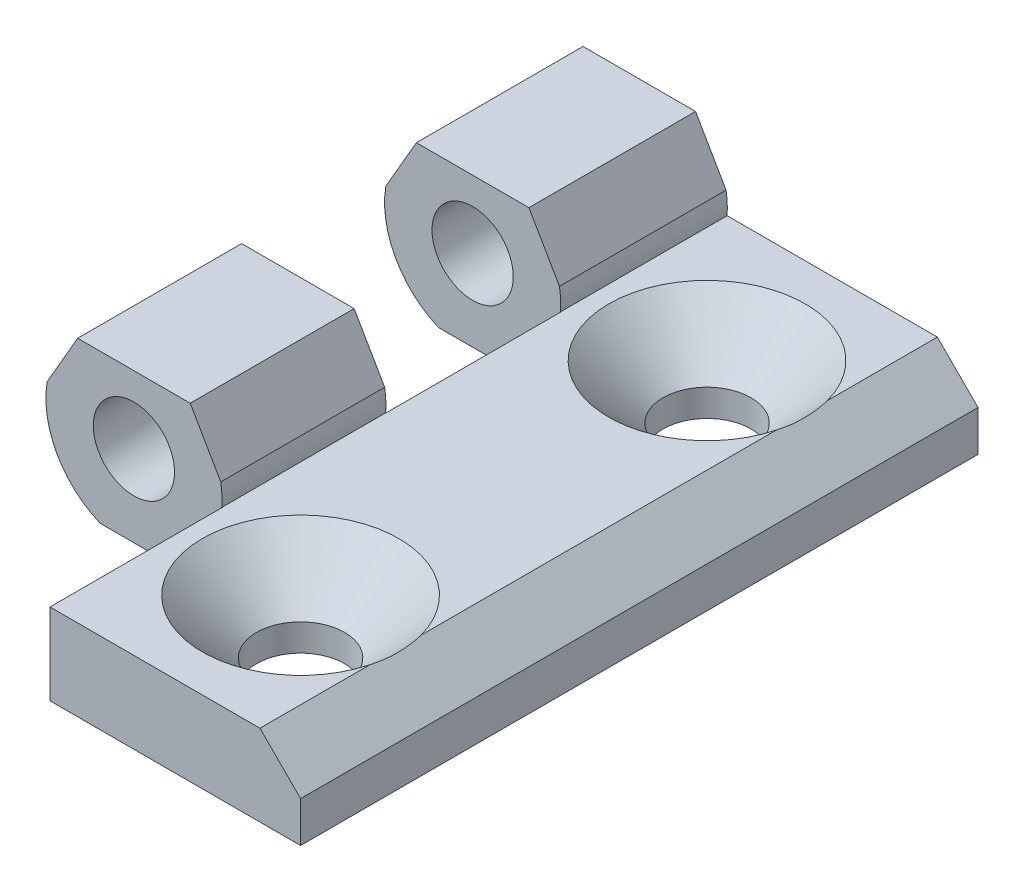
from build123d import *

# Parameters (mm, degrees)
SKETCH2_R           = 3
BOSS_EXTRUDE1_DEPTH = 25
SKETCH3_R           = 3.25
CUT_EXTRUDE1_DEPTH  = 36.860842154
CHAMFER1_SIZE       = 4
CUT_EXTRUDE2_DEPTH  = 57.278326201
SKETCH5_W           = 13
SKETCH5_H           = 12.5
CUT_EXTRUDE3_DEPTH  = 38.17862289
SKETCH6_W           = 13
SKETCH6_H           = 0.2
CUT_EXTRUDE4_DEPTH  = 38.17862289


with BuildPart() as part:
    # Sketch2 → Boss-Extrude1 (new, symmetric)
    with BuildSketch(Plane.XY):
        with BuildLine():
            Line((25, -6.5), (2, -6.5))
            Line((2, -6.5), (2, -6))
            Line((2, -6), (-2.5, -6))
            ThreePointArc((-2.5, -6), (-6.427802106, -0.966105629), (-4.153311931, 5))
            Line((-4.153311931, 5), (4.153311931, 5))
            ThreePointArc((4.153311931, 5), (5.986089611, 2.533126757), (6.480740698, -0.5))
            Line((6.480740698, -0.5), (22, -0.5))
            Line((22, -0.5), (25, -3.5))
            Line((25, -3.5), (25, -6.5))
        make_face()
        Circle(SKETCH2_R, mode=Mode.SUBTRACT)
    extrude(amount=BOSS_EXTRUDE1_DEPTH, both=True)

    # Sketch3 → Cut-Extrude1 (cut, through all)
    with BuildSketch(Plane(origin=(0, -0.5, 0), x_dir=(1, 0, 0), z_dir=(0, 1, 0))):
        with Locations(Location((15, 15, 0), (0, 0, 180))):
            Circle(SKETCH3_R)
        with Locations(Location((15, -15, 0), (0, 0, 180))):
            Circle(SKETCH3_R)
    extrude(amount=-CUT_EXTRUDE1_DEPTH, mode=Mode.SUBTRACT)

    # Chamfer1
    # the kernel refuses this chamfer: 4 mm, written as the material it takes off along each edge
    with BuildSketch(Plane(origin=(15, -0.5, -15), x_dir=(-1, 0, 0), z_dir=(0, 0, -1))) as chamfer1_piece_1:
        Polygon((3.25, -CHAMFER1_SIZE), (3.25 + CHAMFER1_SIZE, 0), (3.25, 0), align=None)
    revolve(axis=Axis((15, -0.5, -15), (0, 1, 0)), mode=Mode.SUBTRACT)
    with BuildSketch(Plane(origin=(15, -0.5, 15), x_dir=(-1, 0, 0), z_dir=(0, 0, -1))) as chamfer1_piece_2:
        Polygon((3.25, -CHAMFER1_SIZE), (3.25 + CHAMFER1_SIZE, 0), (3.25, 0), align=None)
    revolve(axis=Axis((15, -0.5, 15), (0, 1, 0)), mode=Mode.SUBTRACT)

    # Sketch4 → Cut-Extrude2 (cut, through all)
    with BuildSketch(Plane.XY.offset(25)):
        with BuildLine():
            Line((6.406782985, 1.096873642), (4.153311931, 5))
            ThreePointArc((4.153311931, 5), (5.629165125, 3.25), (6.406782985, 1.096873642))
        make_face()
        with BuildLine():
            Line((-4.153311931, 5), (-6.406782985, 1.096873642))
            ThreePointArc((-6.406782985, 1.096873642), (-5.629165125, 3.25), (-4.153311931, 5))
        make_face()
    extrude(amount=-CUT_EXTRUDE2_DEPTH, mode=Mode.SUBTRACT)

    # Sketch5 → Cut-Extrude3 (cut, through all)
    with BuildSketch(Plane(origin=(0, 5, 0), x_dir=(1, 0, 0), z_dir=(0, 1, 0))):
        with Locations((0, -18.75)):
            Rectangle(SKETCH5_W, SKETCH5_H)
        with Locations((0, 6.25)):
            Rectangle(SKETCH5_W, SKETCH5_H)
    extrude(amount=-CUT_EXTRUDE3_DEPTH, mode=Mode.SUBTRACT)

    # Sketch6 → Cut-Extrude4 (cut, through all)
    with BuildSketch(Plane(origin=(0, 5, 0), x_dir=(1, 0, 0), z_dir=(0, 1, 0))):
        with Locations((0, -0.1)):
            Rectangle(SKETCH6_W, SKETCH6_H)
        with Locations((0, -12.4)):
            Rectangle(SKETCH6_W, SKETCH6_H)
        with Locations((0, 12.6)):
            Rectangle(SKETCH6_W, SKETCH6_H)
    extrude(amount=-CUT_EXTRUDE4_DEPTH, mode=Mode.SUBTRACT)


solid = part.part
